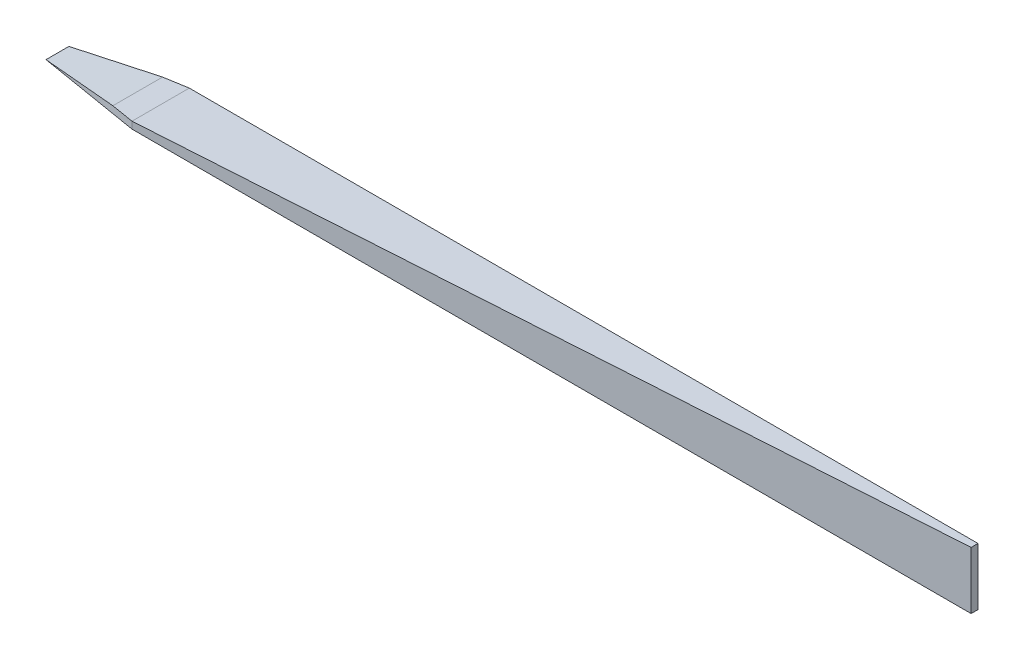
from build123d import *

# Parameters (mm, degrees)
BOSS_EXTRUDE1_DEPTH = 0.06
CUT_EXTRUDE3_DEPTH  = 9.09728967
CUT_EXTRUDE4_DEPTH  = 9.09728967
CUT_EXTRUDE5_DEPTH  = 2.5
SKETCH7_W           = 7.1
SKETCH7_H           = 0.5
CUT_EXTRUDE6_DEPTH  = 2.5


with BuildPart() as part:
    # Sketch1 → Boss-Extrude1 (new body)
    with BuildSketch(Plane(origin=(0, 0, 0), x_dir=(1, 0, 0), z_dir=(0, 1, 0))):
        with BuildLine():
            ThreePointArc((-0.362264151, -0.932075472), (-0.747576714, -0.664175471), (-0.968245837, -0.25))
            Line((-0.968245837, -0.25), (-4, -0.25))
            Line((-4, -0.25), (-0.362264151, -0.932075472))
        make_face()
        with BuildLine():
            ThreePointArc((-0.968245837, 0.25), (-0.747576714, 0.664175471), (-0.362264151, 0.932075472))
            Line((-0.362264151, 0.932075472), (-4, 0.25))
            Line((-4, 0.25), (-0.968245837, 0.25))
        make_face()
        with BuildLine():
            ThreePointArc((-0.968245837, -0.25), (-1, 0), (-0.968245837, 0.25))
            Line((-0.968245837, 0.25), (-4, 0.25))
            Line((-4, 0.25), (-8, 0.25))
            Line((-8, 0.25), (-8, -0.25))
            Line((-8, -0.25), (-4, -0.25))
            Line((-4, -0.25), (-0.968245837, -0.25))
        make_face()
        with BuildLine():
            Line((0, -1), (0, -0.25))
            Line((0, -0.25), (-0.968245837, -0.25))
            ThreePointArc((-0.968245837, -0.25), (-0.747576714, -0.664175471), (-0.362264151, -0.932075472))
            Line((-0.362264151, -0.932075472), (0, -1))
        make_face()
        with BuildLine():
            Line((0, 0.25), (0, 1))
            Line((0, 1), (-0.362264151, 0.932075472))
            ThreePointArc((-0.362264151, 0.932075472), (-0.747576714, 0.664175471), (-0.968245837, 0.25))
            Line((-0.968245837, 0.25), (0, 0.25))
        make_face()
        with BuildLine():
            Line((0, -0.25), (0, 0.25))
            Line((0, 0.25), (-0.968245837, 0.25))
            ThreePointArc((-0.968245837, 0.25), (-1, 0), (-0.968245837, -0.25))
            Line((-0.968245837, -0.25), (0, -0.25))
        make_face()
    extrude(amount=BOSS_EXTRUDE1_DEPTH)

    # Sketch5 → Cut-Extrude3 (cut, through all)
    with BuildSketch(Plane.XY.offset(0.25)):
        Polygon((-8, 0), (-8, 0.06), (-7.3, 0.06), align=None)
    extrude(amount=-CUT_EXTRUDE3_DEPTH, mode=Mode.SUBTRACT)

    # 3DSketch1 → Cut-Extrude4 (cut, through all)
    with BuildSketch(Plane(origin=(-8, 0.06, 0.25), x_dir=(0.8741572761215382, 0, -0.48564293117863155), z_dir=(0, 1, 0))):
        Polygon((0, 0), (0.07284644, 0.131123591), (0.786741549, -0.437078638), align=None)
        Polygon((1.029563014, 0), (0.242821466, 0.437078638), (0.169975026, 0.305955047), align=None)
    extrude(amount=-CUT_EXTRUDE4_DEPTH, mode=Mode.SUBTRACT)

    # Sketch6 → Cut-Extrude5 (cut)
    with BuildSketch(Plane(origin=(0, 0.06, 0), x_dir=(1, 0, 0), z_dir=(0, 1, 0))):
        Polygon((0, 1), (-4, 0.25), (0, 0.25), align=None)
        Polygon((0, -0.25), (-4, -0.25), (0, -1), align=None)
    extrude(amount=-CUT_EXTRUDE5_DEPTH, mode=Mode.SUBTRACT)

    # Sketch7 → Cut-Extrude6 (cut)
    with BuildSketch(Plane(origin=(0, 0.06, 0), x_dir=(1, 0, 0), z_dir=(0, 1, 0))):
        with Locations((-3.55, 0)):
            Rectangle(SKETCH7_W, SKETCH7_H)
    extrude(amount=-CUT_EXTRUDE6_DEPTH, mode=Mode.SUBTRACT)

    # Loft2: read off the stored shape, not the designer's step
    # Loft2: loft between two sections, ruled curve by curve
    loft2_from = [
        Edge.make_line((0, 0.28, 0.03), (0, 0.28, -0.03)),
        Edge.make_line((0, 0.28, -0.03), (0, -0.22, -0.03)),
        Edge.make_line((0, -0.22, 0.03), (0, 0.28, 0.03)),
        Edge.make_line((0, -0.22, -0.03), (0, -0.22, 0.03)),
    ]
    loft2_to = [
        Edge.make_line((-7.1, 0.06, 0.25), (-7.1, 0.06, -0.25)),
        Edge.make_line((-7.1, 0.06, -0.25), (-7.1, 0, -0.25)),
        Edge.make_line((-7.1, 0, 0.25), (-7.1, 0.06, 0.25)),
        Edge.make_line((-7.1, 0, -0.25), (-7.1, 0, 0.25)),
    ]
    loft2 = Solid(Shell([*[Face.make_surface_from_curves(loft2_from[k], loft2_to[k]) for k in range(4)], Face(Wire(loft2_from)), Face(Wire(loft2_to))]))
    add(loft2)


solid = part.part
